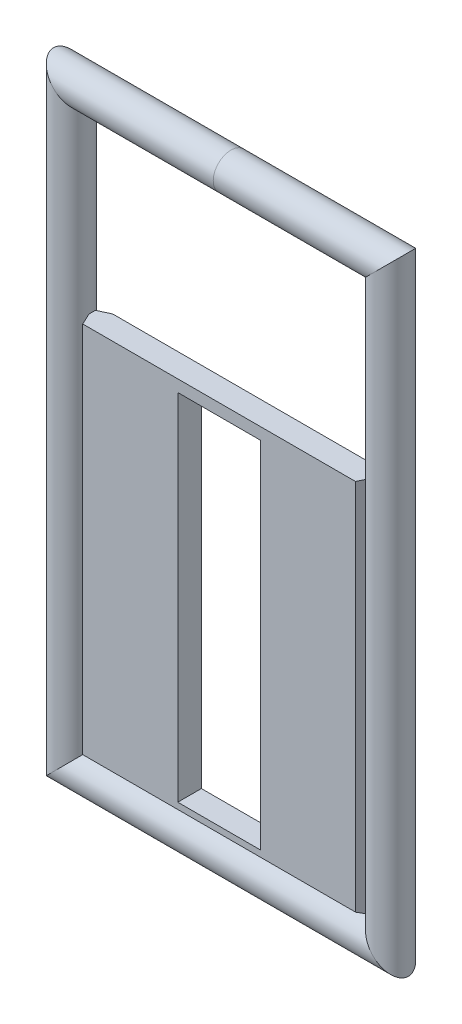
from build123d import *

# Parameters (mm, degrees)
SWEEP1_PROFILE_R         = 0.75
BOSS_EXTRUDE1_DEPTH      = 0.5
BOSS_EXTRUDE1_DEPTH_BACK = 0.5
SKETCH15_W               = 12
SKETCH15_H               = 16
SKETCH15_W_2             = 3.5
SKETCH15_H_2             = 15
CHAMFER1_SIZE            = 0.5
CHAMFER1_SIZE_2          = 0.233153829


with BuildPart() as part:
    # Sweep1: sweep along a path in Sketch1
    with BuildLine(Plane.XY) as sweep1_path:
        Line((0, 0), (-6.75, 0))
        Line((-6.75, 0), (-6.75, -25))
        Line((-6.75, -25), (6.75, -25))
        Line((6.75, -25), (6.75, 0))
        Line((6.75, 0), (0, 0))
    # Sweep1 profile (on start of the path) → Sweep1 (sweep)
    with BuildSketch(Plane(origin=(0, 0, 0), x_dir=(0, 0, -1), z_dir=(-1, 0, 0))):
        Circle(SWEEP1_PROFILE_R)
    sweep(path=sweep1_path.line, transition=Transition.RIGHT)


with BuildPart() as body_2:
    # Sketch15 → Boss-Extrude1 (new, two sides: drawn at the far end of the back side and taken through both)
    with BuildSketch(Plane.XY.offset(-BOSS_EXTRUDE1_DEPTH_BACK)):
        with Locations((0, -16.25)):
            Rectangle(SKETCH15_W, SKETCH15_H)
        with Locations((0, -16.25)):
            Rectangle(SKETCH15_W_2, SKETCH15_H_2, mode=Mode.SUBTRACT)
    extrude(amount=BOSS_EXTRUDE1_DEPTH + BOSS_EXTRUDE1_DEPTH_BACK)

    # Chamfer1
    # the kernel refuses this chamfer: 0.5, 0.233153829 mm, written as the material it takes off along each edge
    with BuildSketch(Plane(origin=(-6, -25.545487736, -0.5), x_dir=(0.9998669641130704, 0, -0.016311164131110275), z_dir=(0, 1, 0)), Plane(origin=(6, -6.954512264, 0.5), x_dir=(0.016311164131110483, 0, -0.9998669641130704), z_dir=(0, -1, 0)), Plane(origin=(-6, -25.545487736, 0.5), x_dir=(-0.016311164131110483, 0, -0.9998669641130704), z_dir=(0, 1, 0))) as chamfer1_piece_1:
        Polygon((CHAMFER1_SIZE * 0.999866964113, -CHAMFER1_SIZE * 0.0163111641311), (-CHAMFER1_SIZE_2 * 0.0163111641365, -CHAMFER1_SIZE_2 * 0.999866964445), (0, 0), align=None)
    extrude(amount=18.590975471, mode=Mode.SUBTRACT)
    with BuildSketch(Plane(origin=(7.295487736, -24.25, -0.5), x_dir=(0, -0.07481330637060621, 0.9971975577536769), z_dir=(-1, 0, 0))) as chamfer1_piece_2:
        Polygon((CHAMFER1_SIZE_2 * 0.997197558085, CHAMFER1_SIZE_2 * 0.0748133063955), (-CHAMFER1_SIZE * 0.0748133063706, CHAMFER1_SIZE * 0.997197557754), (0, 0), align=None)
    extrude(amount=14.590975471, mode=Mode.SUBTRACT)
    with BuildSketch(Plane(origin=(6, -6.954512264, -0.5), x_dir=(0.07481330637059892, 0, 0.9971975577536775), z_dir=(0, -1, 0))) as chamfer1_piece_3:
        Polygon((CHAMFER1_SIZE_2 * 0.997197558085, CHAMFER1_SIZE_2 * 0.0748133063955), (-CHAMFER1_SIZE * 0.0748133063706, CHAMFER1_SIZE * 0.997197557754), (0, 0), align=None)
    extrude(amount=18.590975471, mode=Mode.SUBTRACT)
    with BuildSketch(Plane(origin=(7.295487736, -24.25, 0.5), x_dir=(0, -0.01631116413110877, -0.9998669641130704), z_dir=(-1, 0, 0))) as chamfer1_piece_4:
        Polygon((CHAMFER1_SIZE * 0.999866964113, -CHAMFER1_SIZE * 0.0163111641311), (-CHAMFER1_SIZE_2 * 0.0163111641365, -CHAMFER1_SIZE_2 * 0.999866964445), (0, 0), align=None)
    extrude(amount=14.590975471, mode=Mode.SUBTRACT)


solid = Compound([part.part, body_2.part])
